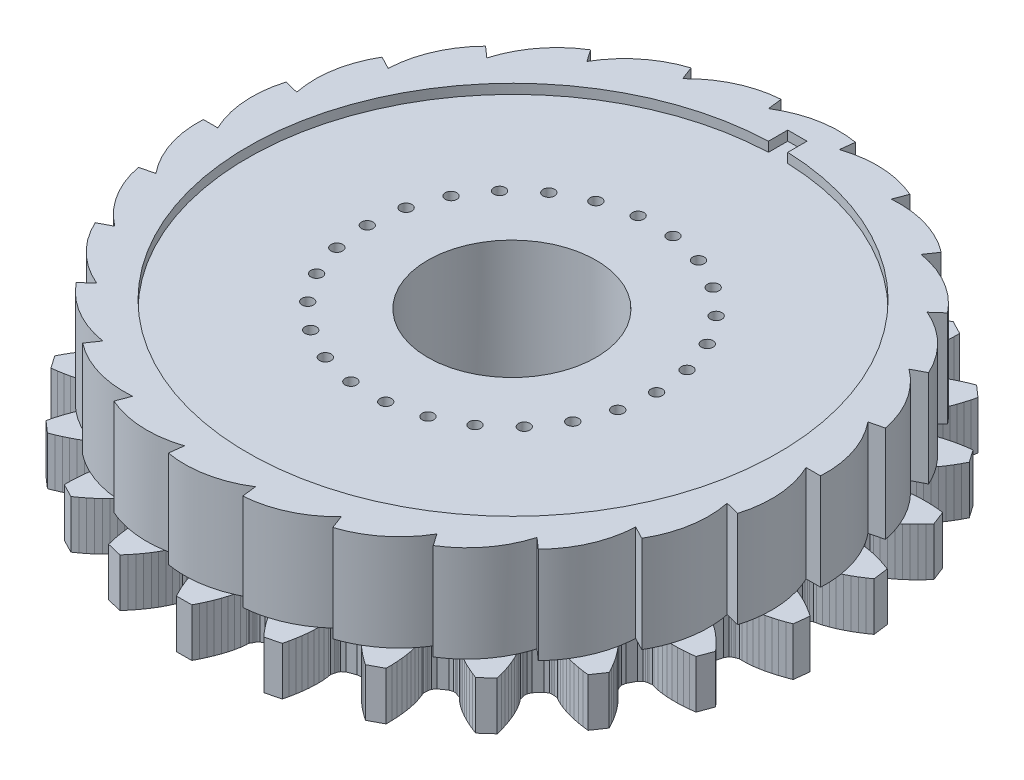
from build123d import *

# Parameters (mm, degrees)
EXTRUDE_RATCHET_EDGE_DEPTH      = 10
PATTERN_EDGE_TO_FORM_GEAR_COUNT = 26
BOSS_EXTRUDE1_DEPTH             = 5
CUT_EXTRUDE1_DEPTH              = 1
SKETCH7_R                       = 8.73125
CUT_BEARING_HOLE_DEPTH          = 51.540175005
CUT_EXTRUDE2_DEPTH              = 1
PIN_HOLES_R                     = 0.6
PIN_HOLES_CUT_DEPTH             = 51.252455557


with BuildPart() as part:
    # Sketch1 → Extrude ratchet edge (new body)
    with BuildSketch(Plane(origin=(0, 0, 0), x_dir=(1, 0, 0), z_dir=(0, 1, 0))):
        with BuildLine():
            Line((0, 0), (29.613725431, 7.299127761))
            ThreePointArc((29.613725431, 7.299127761), (31.486736206, 3.871832194), (32, 0))
            Line((32, 0), (0, 0))
        make_face()
    extrude_ratchet_edge = extrude(amount=EXTRUDE_RATCHET_EDGE_DEPTH)

    # Pattern edge to form gear: Extrude ratchet edge ×26 about axis
    pattern_edge_to_form_gear_axis = Axis((0, 10, 0), (0, -1, 0))
    for i in range(1, PATTERN_EDGE_TO_FORM_GEAR_COUNT):
        add(extrude_ratchet_edge.rotate(pattern_edge_to_form_gear_axis, i * 360 / PATTERN_EDGE_TO_FORM_GEAR_COUNT))

    # Sketch12 → Boss-Extrude1 (add)
    with BuildSketch(Plane.XZ):
        Polygon((29.000322753, -0.616570725), (29.119587194, -1.000264746), (29.243967752, -1.150641256), (29.369415025, -1.259655253), (29.495529063, -1.346043346), (29.746268189, -1.535119797), (30.003897471, -1.579567436), (30.516640797, -1.712184271), (31.026553539, -1.886135894), (31.533608527, -2.093643068), (32.037579583, -2.330772238), (32.538146653, -2.595046761), (33.034971107, -2.88478205), (33.527666394, -3.198716608), (34.015860093, -3.535858565), (33.816447683, -5.104204368), (33.259423516, -5.308446667), (32.70383632, -5.489091421), (32.150321721, -5.64527418), (31.599542211, -5.775878742), (31.052267075, -5.879342703), (30.509417131, -5.953364719), (29.972196294, -5.994166602), (29.442574568, -5.994244969), (29.182025762, -5.972811667), (28.891944574, -6.093118219), (28.748223432, -6.14520138), (28.599490608, -6.219357083), (28.441444822, -6.333825435), (28.229944358, -6.675452702), (28.011930996, -7.539016124), (28.035905017, -7.940101093), (28.120680504, -8.11587518), (28.216392404, -8.251742207), (28.318171308, -8.365801825), (28.516371494, -8.609392662), (28.755875004, -8.714201654), (29.221984208, -8.965662), (29.675451563, -9.256588057), (30.118114109, -9.579423324), (30.550688568, -9.930264942), (30.973466667, -10.306654274), (31.38651869, -10.706875291), (31.789774507, -11.129589828), (32.183089813, -11.57376402), (31.614148649, -13.048821615), (31.024422442, -13.113824584), (30.441754669, -13.156257212), (29.866940695, -13.175436936), (29.300913124, -13.170433674), (28.74478387, -13.139917408), (28.199989292, -13.081870202), (27.668616724, -12.992938215), (27.154372567, -12.866268078), (26.906519987, -12.783095695), (26.596074859, -12.830488087), (26.444073202, -12.84666541), (26.281906356, -12.883072461), (26.101055542, -12.956387938), (25.813953244, -13.237478936), (25.395601274, -14.023771373), (25.322903049, -14.418937666), (25.36315151, -14.609882908), (25.423567498, -14.764713169), (25.495086212, -14.899815322), (25.629240235, -15.18375337), (25.836700176, -15.34283377), (26.229084437, -15.698545455), (26.5997556, -16.089541872), (26.952297616, -16.508926), (27.288334305, -16.95309792), (27.60874497, -17.419728423), (27.914013523, -17.907159909), (28.204392535, -18.414097386), (28.479987881, -18.939503891), (27.57456612, -20.235536172), (26.986427049, -20.157520075), (26.410536073, -20.059275238), (25.847829895, -19.940331997), (25.299444988, -19.800019952), (24.766779121, -19.637304534), (24.251710057, -19.450565246), (23.757057144, -19.237040752), (23.288067034, -18.990988592), (23.06732386, -18.850919437), (22.754565163, -18.822639205), (22.603105727, -18.80196765), (22.436947, -18.798508986), (22.243802823, -18.826415616), (21.897766118, -19.030625641), (21.303407339, -19.69395104), (21.138250905, -20.060236642), (21.131629113, -20.255270487), (21.15323291, -20.420055664), (21.190345242, -20.568356596), (21.252649168, -20.876147677), (21.416005351, -21.080258001), (21.711860329, -21.51952615), (21.97818652, -21.987869562), (22.220124958, -22.479441164), (22.440105609, -22.991119504), (22.639534349, -23.520878226), (22.819282941, -24.067199626), (22.979900363, -24.628903355), (23.121744765, -25.204989299), (21.9324827, -26.246678064), (21.380095096, -26.030181096), (20.844455941, -25.796974682), (20.326564429, -25.54682621), (19.827692045, -25.279348604), (19.349446711, -24.993886816), (18.894032469, -24.689313949), (18.464858212, -24.363608827), (18.068377547, -24.012467795), (17.887567892, -23.823651875), (17.590666424, -23.721340283), (17.448544138, -23.665021206), (17.28804749, -23.621901858), (17.093840034, -23.602769671), (16.708985836, -23.718239631), (15.97315002, -24.220048013), (15.725134742, -24.536171365), (15.672029434, -24.723948024), (15.653578582, -24.889120029), (15.65411946, -25.041981213), (15.640952821, -25.355750311), (15.750721025, -25.593020658), (15.932857792, -26.090329901), (16.079363355, -26.608802942), (16.196623032, -27.143979485), (16.287754102, -27.693433061), (16.35461331, -28.255524246), (16.398396125, -28.828988744), (16.419920067, -29.412802364), (16.419780819, -30.00610275), (15.015774768, -30.732908811), (14.531260836, -30.390507062), (14.066985306, -30.035889374), (13.624010391, -29.669070177), (13.203654281, -29.289980387), (12.807615735, -28.898360741), (12.438328878, -28.493653084), (12.099558756, -28.074708794), (11.798647374, -27.638890005), (11.668278983, -27.412282401), (11.404480071, -27.241895059), (11.279977476, -27.153199468), (11.134456303, -27.072915431), (10.9504697, -27.007865397), (10.549167493, -27.027885368), (9.714626697, -27.339008242), (9.398160425, -27.586590109), (9.301665544, -27.756212723), (9.244218621, -27.912162987), (9.208153758, -28.06071406), (9.120282206, -28.362206086), (9.170082238, -28.618851478), (9.2279035, -29.145296822), (9.246079579, -29.683763509), (9.23185423, -30.231458603), (9.188847542, -30.786760421), (9.119242017, -31.348513156), (9.024511085, -31.915788421), (8.905705047, -32.48780017), (8.763586696, -33.063817482), (7.226437894, -33.433502275), (6.837937921, -32.985100273), (6.472031404, -32.529676197), (6.129704286, -32.06750883), (5.812280994, -31.598839186), (5.521481747, -31.123817442), (5.259772592, -30.642494605), (5.031107581, -30.154653437), (4.843234592, -29.659477328), (4.770887712, -29.408259386), (4.555530022, -29.179687086), (4.455867025, -29.06377419), (4.333788034, -28.951008769), (4.170714536, -28.843816474), (3.776294925, -28.76721382), (2.891539758, -28.869578615), (2.52502445, -29.034226188), (2.390731304, -29.175828609), (2.297638331, -29.313489378), (2.227069377, -29.449108533), (2.069602914, -29.720802038), (2.056530545, -29.981914038), (1.986690404, -30.506898661), (1.875468101, -31.03407206), (1.730592111, -31.562438391), (1.555941953, -32.091313679), (1.353929162, -32.620090883), (1.126186865, -33.148213767), (0.873939275, -33.675157544), (0.598102076, -34.200433621), (-0.982851482, -34.19151211), (-1.252752475, -33.663173567), (-1.499045823, -33.133407539), (-1.720812391, -32.602746652), (-1.916852382, -32.071728851), (-2.085523982, -31.540918984), (-2.224440638, -31.01095302), (-2.329708953, -30.482558192), (-2.393621941, -29.956812623), (-2.403747439, -29.695584546), (-2.558141053, -29.42212011), (-2.627173971, -29.285726091), (-2.718708913, -29.147016563), (-2.851390134, -29.003914445), (-3.216023003, -28.835136551), (-4.099572907, -28.722804032), (-4.494838802, -28.794949523), (-4.659110773, -28.900291221), (-4.782449698, -29.011688949), (-4.883410877, -29.126470152), (-5.101335582, -29.352585333), (-5.176514332, -29.602973032), (-5.369956259, -30.096002681), (-5.604102212, -30.581231923), (-5.871223617, -31.059577533), (-6.167361801, -31.531292677), (-6.490054901, -31.996348472), (-6.837566872, -32.454623894), (-7.208597359, -32.905900588), (-7.602119825, -33.349894441), (-9.1349949, -32.962888546), (-9.270609169, -32.385304489), (-9.382967634, -31.811999182), (-9.471292057, -31.243682867), (-9.534557726, -30.68118305), (-9.571304238, -30.125424566), (-9.579345414, -29.577614654), (-9.555100785, -29.039388168), (-9.49133995, -28.513620637), (-9.438659317, -28.257552614), (-9.523124814, -27.95508868), (-9.557507096, -27.806143986), (-9.613188717, -27.649553535), (-9.707771765, -27.4788597), (-10.02141522, -27.227720352), (-10.85239872, -26.907201408), (-11.253452365, -26.882667311), (-11.438160264, -26.945630464), (-11.584575193, -27.024271004), (-11.710068905, -27.111558462), (-11.975772252, -27.27895371), (-12.108692281, -27.504078732), (-12.41450145, -27.936476133), (-12.757967791, -28.351570645), (-13.131798323, -28.752094327), (-13.532226416, -29.139221659), (-13.956837652, -29.513547094), (-14.403925504, -29.875341691), (-14.872162885, -30.224706134), (-15.360509126, -30.561625939), (-16.756226668, -29.819024441), (-16.749676303, -29.225768585), (-16.721567424, -28.642237772), (-16.671323655, -28.069303029), (-16.598129513, -27.508003101), (-16.500806914, -26.959608074), (-16.377516144, -26.425783946), (-16.225174127, -25.908992736), (-16.037444855, -25.413769059), (-15.925002996, -25.177750852), (-15.934633726, -24.863864715), (-15.93237059, -24.711006785), (-15.948957519, -24.54564826), (-15.999945901, -24.357278631), (-16.244380529, -24.038384318), (-16.97450652, -23.528307117), (-17.358032081, -23.408505109), (-17.552442054, -23.425442954), (-17.713420589, -23.466754535), (-17.856162622, -23.521470062), (-18.154202757, -23.620413876), (-18.337128687, -23.807183441), (-18.737535133, -24.153834168), (-19.170366722, -24.474676527), (-19.629185448, -24.774089579), (-20.110618025, -25.054149625), (-20.612472996, -25.315973506), (-21.133151156, -25.560268493), (-21.671390651, -25.787419074), (-22.226177153, -25.997672501), (-23.403626964, -24.942639576), (-23.255288098, -24.368188855), (-23.088349817, -23.80833472), (-22.902449685, -23.264069562), (-22.697053973, -22.736597099), (-22.471322079, -22.227435416), (-22.223855341, -21.738624109), (-21.952265664, -21.27331251), (-21.651477182, -20.837403058), (-21.485824938, -20.635156317), (-21.420055759, -20.328083392), (-21.381271653, -20.180210934), (-21.357809987, -20.015687572), (-21.362236574, -19.82059187), (-21.523243562, -19.452463818), (-22.110092119, -18.782478907), (-22.453804627, -18.574372227), (-22.646613151, -18.544291821), (-22.812807694, -18.545881951), (-22.964493043, -18.564846539), (-23.277546869, -18.589594427), (-23.499862021, -18.727158029), (-23.971598705, -18.967906757), (-24.468627261, -19.175844193), (-24.98576773, -19.356757169), (-25.520238803, -19.513463985), (-26.070163438, -19.647578616), (-26.634174291, -19.760160953), (-27.211133094, -19.851912386), (-27.800124899, -19.92328565), (-28.690864881, -18.617123329), (-28.409361987, -18.094864868), (-28.113294466, -17.591229677), (-27.802546925, -17.107273162), (-27.476891545, -16.644285167), (-27.1358604, -16.203933489), (-26.77861044, -15.788547198), (-26.403559404, -15.401758463), (-26.007179513, -15.050502158), (-25.797945655, -14.893766904), (-25.660597374, -14.611361624), (-25.587555822, -14.477064875), (-25.525397405, -14.322930519), (-25.48300824, -14.132450996), (-25.551244776, -13.736489569), (-25.960701815, -12.945524905), (-26.244620576, -12.661214427), (-26.424630906, -12.585862173), (-26.586363252, -12.547634199), (-26.738187542, -12.529745553), (-27.048075686, -12.4788541), (-27.296840395, -12.559223583), (-27.812481624, -12.680085797), (-28.344830202, -12.763030442), (-28.890241656, -12.814926193), (-29.446685345, -12.839171433), (-30.012733696, -12.837784214), (-30.587294313, -12.81211922), (-31.169446576, -12.763119563), (-31.758393322, -12.691474467), (-32.310669441, -11.210098191), (-31.912366652, -10.770380015), (-31.50437105, -10.352244135), (-31.086839486, -9.956710155), (-30.659842686, -9.585103596), (-30.223339518, -9.239164688), (-29.777060902, -8.921352719), (-29.320342312, -8.635558244), (-28.851424719, -8.389359586), (-28.610758156, -8.287264153), (-28.40981339, -8.045926773), (-28.306761313, -7.933018707), (-28.20952209, -7.798234883), (-28.122771512, -7.623435151), (-28.094268231, -7.222644135), (-28.302534861, -6.35667719), (-28.510162717, -6.012682159), (-28.666910843, -5.896446425), (-28.814801839, -5.820622528), (-28.957928583, -5.766919605), (-29.246631907, -5.643339808), (-29.507410899, -5.661843284), (-30.036983429, -5.655790674), (-30.573721657, -5.608927158), (-31.115698356, -5.528792204), (-31.661774369, -5.419161369), (-32.211037265, -5.282350073), (-32.76276366, -5.119932614), (-33.31627317, -4.933044941), (-33.870961032, -4.722526552), (-34.052673274, -3.152034331), (-33.560714796, -2.820412738), (-33.064502668, -2.512060415), (-32.564446541, -2.227950137), (-32.060931426, -1.969333767), (-31.554319305, -1.737902569), (-31.044951834, -1.536117796), (-30.53311266, -1.367929707), (-30.018904959, -1.24111436), (-29.760795544, -1.19956902), (-29.507935476, -1.013340126), (-29.380858158, -0.928372969), (-29.254185749, -0.820775989), (-29.128129032, -0.671814544), (-29.004538852, -0.289492375), (-28.999514125, 0.601141182), (-29.118778566, 0.984835202), (-29.243159124, 1.135211713), (-29.368606397, 1.24422571), (-29.494720435, 1.330613803), (-29.745459561, 1.519690254), (-30.003078857, 1.564138416), (-30.515832169, 1.696754727), (-31.025744911, 1.870706351), (-31.532799898, 2.078213525), (-32.036770955, 2.315342695), (-32.537338025, 2.579617218), (-33.034162479, 2.869352507), (-33.526857766, 3.183287064), (-34.015051465, 3.520429021), (-33.815639055, 5.088774824), (-33.258614888, 5.293017123), (-32.703027691, 5.473661878), (-32.149513093, 5.629844637), (-31.598733583, 5.760449198), (-31.051458447, 5.86391316), (-30.508608503, 5.937935175), (-29.971378203, 5.978747568), (-29.441765939, 5.978815426), (-29.181217134, 5.957382123), (-28.891135946, 6.077688675), (-28.747414804, 6.129771837), (-28.59868198, 6.203927539), (-28.440636194, 6.318395892), (-28.229136253, 6.660033145), (-28.011122368, 7.52358658), (-28.035096389, 7.92467155), (-28.119871875, 8.100445636), (-28.215583776, 8.236312663), (-28.31736268, 8.350372282), (-28.515562866, 8.593963118), (-28.755066376, 8.69877211), (-29.22117558, 8.950232457), (-29.674643458, 9.2411685), (-30.11730548, 9.56399378), (-30.54987994, 9.914835398), (-30.972658039, 10.291224731), (-31.385710062, 10.691445747), (-31.788965879, 11.114160284), (-32.182281185, 11.558334477), (-31.613340021, 13.033392072), (-31.023613814, 13.098395041), (-30.44094604, 13.140827669), (-29.866132067, 13.160007393), (-29.300104495, 13.15500413), (-28.743975242, 13.124487865), (-28.199181187, 13.066450645), (-27.667808095, 12.977508672), (-27.153563939, 12.850838534), (-26.905711359, 12.767666151), (-26.595266231, 12.815058544), (-26.443264574, 12.831235866), (-26.281097728, 12.867642918), (-26.100246914, 12.940958394), (-25.813144616, 13.222049393), (-25.394792646, 14.00834183), (-25.322094421, 14.403508123), (-25.362342882, 14.594453365), (-25.42275887, 14.749283626), (-25.494277584, 14.884385778), (-25.62843213, 15.168333813), (-25.835891548, 15.327404226), (-26.228275809, 15.683115911), (-26.598946972, 16.074112328), (-26.951488988, 16.493496456), (-27.287525677, 16.937668377), (-27.607936342, 17.404298879), (-27.913204895, 17.891730366), (-28.203583907, 18.398667843), (-28.479179252, 18.924074348), (-27.573757492, 20.220106629), (-26.985618421, 20.142090531), (-26.409727445, 20.043845695), (-25.847021791, 19.92491244), (-25.29863636, 19.784590409), (-24.765970493, 19.621874991), (-24.250901429, 19.435135703), (-23.756248516, 19.221611208), (-23.287258406, 18.975559048), (-23.066515232, 18.835489893), (-22.753757058, 18.807219648), (-22.602297099, 18.786538107), (-22.436138372, 18.783079442), (-22.242994194, 18.810986073), (-21.896958013, 19.015206084), (-21.302598711, 19.678521497), (-21.137442277, 20.044807098), (-21.130821008, 20.23985093), (-21.152424282, 20.40462612), (-21.189536614, 20.552927052), (-21.251830554, 20.860718657), (-21.415196723, 21.064828458), (-21.711052224, 21.504106592), (-21.977377892, 21.972440019), (-22.21931633, 22.464011621), (-22.439296981, 22.975689961), (-22.638725721, 23.505448683), (-22.818474313, 24.051770083), (-22.979091735, 24.613473812), (-23.120936137, 25.189559755), (-21.931674072, 26.231248521), (-21.379286468, 26.014751553), (-20.843647312, 25.781545139), (-20.325755801, 25.531396667), (-19.826883417, 25.263919061), (-19.348638083, 24.978457272), (-18.893223841, 24.673884406), (-18.464049584, 24.348179283), (-18.067568919, 23.997038251), (-17.886759264, 23.808222332), (-17.589857796, 23.70591074), (-17.44773551, 23.649591662), (-17.287238862, 23.606472314), (-17.093031406, 23.587340127), (-16.708177208, 23.702810087), (-15.972341392, 24.204618469), (-15.724326113, 24.520741822), (-15.671220805, 24.70851848), (-15.652769954, 24.873690486), (-15.653310832, 25.026551669), (-15.640144193, 25.340320768), (-15.749912397, 25.577591115), (-15.932049164, 26.074900358), (-16.078554727, 26.593373398), (-16.195814403, 27.128549942), (-16.286945474, 27.678003517), (-16.353804682, 28.240094703), (-16.397587497, 28.813559201), (-16.419111439, 29.397372821), (-16.418972191, 29.990673206), (-15.01496614, 30.717479268), (-14.530452208, 30.375077518), (-14.066176678, 30.020459831), (-13.623201763, 29.653640633), (-13.202845653, 29.274550843), (-12.806807107, 28.882931198), (-12.43752025, 28.478223541), (-12.098750128, 28.059279251), (-11.797838746, 27.623460461), (-11.667470355, 27.396852858), (-11.403671443, 27.226465516), (-11.279158862, 27.137770448), (-11.133647675, 27.057485887), (-10.949661072, 26.992435853), (-10.548358865, 27.012455825), (-9.713818069, 27.323578698), (-9.397351797, 27.571160566), (-9.300856916, 27.74078318), (-9.243409993, 27.896733444), (-9.20734513, 28.045284517), (-9.119473578, 28.346776543), (-9.16927361, 28.603421934), (-9.227094872, 29.129867278), (-9.245270951, 29.668333966), (-9.231045602, 30.21602906), (-9.188038914, 30.771330878), (-9.118433389, 31.333083612), (-9.023702457, 31.900358877), (-8.904896419, 32.472370627), (-8.762778068, 33.048387938), (-7.225629266, 33.418072731), (-6.837129293, 32.969670729), (-6.47121279, 32.514247177), (-6.128895658, 32.052079287), (-5.811472366, 31.583409643), (-5.520673118, 31.108387899), (-5.258963964, 30.627065061), (-5.030298953, 30.139223894), (-4.842425964, 29.644047785), (-4.770079084, 29.392829842), (-4.554721394, 29.164257543), (-4.455058397, 29.048344646), (-4.332979406, 28.935579226), (-4.169905908, 28.82838693), (-3.775486297, 28.751784276), (-2.89073113, 28.854149072), (-2.524215821, 29.018796644), (-2.389922676, 29.160399066), (-2.296830226, 29.298069821), (-2.226260749, 29.43367899), (-2.068794286, 29.705372494), (-2.055721917, 29.966484494), (-1.985881775, 30.491469118), (-1.874659473, 31.018642516), (-1.729783483, 31.547008847), (-1.555133325, 32.075884136), (-1.353120534, 32.604661339), (-1.125378237, 33.132784224), (-0.873130647, 33.659728001), (-0.597293447, 34.185004077), (0.98366011, 34.176082567), (1.253561103, 33.647744024), (1.499854451, 33.117977996), (1.721620496, 32.587327095), (1.91766101, 32.056299308), (2.08633261, 31.525489441), (2.225249266, 30.995523477), (2.330517582, 30.467128648), (2.394430569, 29.941383079), (2.404556067, 29.680155003), (2.558949681, 29.406690567), (2.627982599, 29.270296547), (2.719517541, 29.131587019), (2.852198762, 28.988484902), (3.216841617, 28.819707531), (4.100381535, 28.707374489), (4.49564743, 28.77951998), (4.659919401, 28.884861678), (4.783258326, 28.996259405), (4.884219506, 29.111040609), (5.10214421, 29.337155789), (5.177322436, 29.587553475), (5.370764887, 30.080573137), (5.60491084, 30.565802379), (5.872032245, 31.044147989), (6.168170429, 31.515863134), (6.490863529, 31.980918928), (6.8383755, 32.43919435), (7.209405987, 32.890471045), (7.602928453, 33.334464897), (9.135803529, 32.947459002), (9.271417797, 32.369874946), (9.383776262, 31.796569638), (9.472100685, 31.228253324), (9.535366355, 30.665753507), (9.572112866, 30.109995023), (9.580154042, 29.562185111), (9.555909413, 29.023958624), (9.492148578, 28.498191094), (9.439467946, 28.24212307), (9.523933442, 27.939659137), (9.558315724, 27.790714443), (9.613997345, 27.634123992), (9.708580393, 27.463430156), (10.022223848, 27.212290809), (10.853207348, 26.891771865), (11.254260993, 26.867237767), (11.438968892, 26.930200921), (11.585383821, 27.00884146), (11.710877533, 27.096128918), (11.97658088, 27.263524166), (12.109500909, 27.488649189), (12.415310078, 27.92104659), (12.758776419, 28.336141102), (13.132606951, 28.736664784), (13.533035044, 29.123792116), (13.95764628, 29.498117551), (14.404734132, 29.859912148), (14.872971513, 30.209276591), (15.361317754, 30.546196395), (16.757035296, 29.803594898), (16.750484932, 29.210339042), (16.722376052, 28.626808228), (16.672132283, 28.053873485), (16.598938141, 27.492573558), (16.501615542, 26.94417853), (16.378324773, 26.410354402), (16.225982755, 25.893563193), (16.038253483, 25.398339515), (15.925811624, 25.162321308), (15.935442354, 24.848435171), (15.933179218, 24.695577242), (15.949766147, 24.530218716), (16.000754529, 24.341849088), (16.245189157, 24.022954774), (16.975315148, 23.512877573), (17.358840709, 23.393075566), (17.553250683, 23.41001341), (17.714229217, 23.451324992), (17.85697125, 23.506040519), (18.155011385, 23.604984333), (18.337937315, 23.791753898), (18.738343761, 24.138404625), (19.17117535, 24.459246983), (19.629994076, 24.758660035), (20.111426653, 25.038720082), (20.613281624, 25.300543962), (21.133959784, 25.544838949), (21.67219928, 25.77198953), (22.226985781, 25.982242957), (23.404435592, 24.927210033), (23.256096727, 24.352759312), (23.089158445, 23.792905177), (22.903257789, 23.248650005), (22.697862601, 22.721167555), (22.472130707, 22.212005872), (22.224663969, 21.723194565), (21.953074293, 21.257882966), (21.65228581, 20.821973515), (21.486633566, 20.619726774), (21.420864387, 20.312653848), (21.382080281, 20.164781391), (21.358618615, 20.000258029), (21.363045202, 19.805162326), (21.52405219, 19.437034274), (22.110900747, 18.767049364), (22.454613255, 18.558942684), (22.647421779, 18.528862278), (22.813616322, 18.530452408), (22.965301672, 18.549416996), (23.278365483, 18.574165406), (23.500670649, 18.711728485), (23.972407333, 18.952477213), (24.469435889, 19.160414649), (24.986576358, 19.341327625), (25.521047431, 19.498034441), (26.070972066, 19.632149072), (26.634982919, 19.74473141), (27.211941722, 19.836482843), (27.800933527, 19.907856106), (28.691673509, 18.601693785), (28.410170615, 18.079435325), (28.114103094, 17.575800134), (27.803355553, 17.091843618), (27.477700173, 16.628855624), (27.136669028, 16.188503946), (26.779419068, 15.773117655), (26.404368032, 15.38632892), (26.007988141, 15.035072615), (25.798754283, 14.87833736), (25.661406002, 14.59593208), (25.58836445, 14.461635332), (25.526206033, 14.307500976), (25.483816868, 14.117021453), (25.552053404, 13.721060026), (25.961510443, 12.930095362), (26.245429204, 12.645784884), (26.425439534, 12.570432629), (26.587171881, 12.532204656), (26.73899617, 12.51431601), (27.048884314, 12.463424557), (27.297649023, 12.54379404), (27.813290252, 12.664656254), (28.34563883, 12.747600898), (28.891050284, 12.79949665), (29.447493973, 12.82374189), (30.013542324, 12.82235467), (30.588102941, 12.796689676), (31.170255204, 12.74769002), (31.75920195, 12.676044924), (32.311478069, 11.194668648), (31.91317528, 10.754950472), (31.505179678, 10.336814591), (31.087648114, 9.941280612), (30.660651315, 9.569674052), (30.224148146, 9.223735144), (29.77786953, 8.905923176), (29.32115094, 8.6201287), (28.852233347, 8.373930043), (28.611566784, 8.27183461), (28.410622018, 8.030497229), (28.307569941, 7.917589163), (28.210330718, 7.782805339), (28.123580141, 7.608005608), (28.095076859, 7.207214591), (28.303343489, 6.341247647), (28.510971345, 5.997252616), (28.667719471, 5.881016882), (28.815610467, 5.805192985), (28.958737211, 5.751490062), (29.247440535, 5.627910264), (29.508219527, 5.646413741), (30.037792057, 5.640361131), (30.574530285, 5.593497614), (31.116506984, 5.513362661), (31.662582997, 5.403731826), (32.211845893, 5.26692053), (32.763572288, 5.104503071), (33.317081798, 4.917615397), (33.87176966, 4.707097009), (34.053481903, 3.136604788), (33.561523424, 2.804983194), (33.065311296, 2.496630872), (32.565255169, 2.212520593), (32.061740055, 1.953904223), (31.555127933, 1.722473025), (31.045760462, 1.520688252), (30.533921289, 1.352500164), (30.019713587, 1.225684816), (29.761604172, 1.184139477), (29.508744104, 0.997910583), (29.381666786, 0.912943425), (29.254994377, 0.805346446), (29.12893766, 0.656385001), (29.00534748, 0.274062831), align=None)
    extrude(amount=BOSS_EXTRUDE1_DEPTH)

    # Sketch10 → Cut-Extrude1 (cut)
    with BuildSketch(Plane(origin=(0, 10, 0), x_dir=(1, 0, 0), z_dir=(0, 1, 0))):
        with BuildLine():
            Line((-0.753755436, 29.351723584), (-0.753755436, 27.351723584))
            ThreePointArc((-0.753755436, 27.351723584), (0.246244564, -27.630088583), (1.246244564, 27.351723584))
            Line((1.246244564, 27.351723584), (1.246244564, 29.351723584))
            Line((1.246244564, 29.351723584), (-0.753755436, 29.351723584))
        make_face()
    extrude(amount=-CUT_EXTRUDE1_DEPTH, mode=Mode.SUBTRACT)

    # Sketch7 → Cut bearing hole (cut, through all)
    with BuildSketch(Plane(origin=(0, 10, 0), x_dir=(1, 0, 0), z_dir=(0, 1, 0))):
        Circle(SKETCH7_R)
    extrude(amount=-CUT_BEARING_HOLE_DEPTH, mode=Mode.SUBTRACT)

    # Sketch11 → Cut-Extrude2 (cut)
    with BuildSketch(Plane.XZ.offset(5)):
        with BuildLine():
            Line((1, -29.481812167), (1, -27.481812167))
            ThreePointArc((1, -27.481812167), (0, 27.5), (-1, -27.481812167))
            Line((-1, -27.481812167), (-1, -29.481812167))
            Line((-1, -29.481812167), (1, -29.481812167))
        make_face()
    extrude(amount=-CUT_EXTRUDE2_DEPTH, mode=Mode.SUBTRACT)

    # pin holes → Pin holes cut (cut, through all)
    with BuildSketch(Plane(origin=(0, 9, 0), x_dir=(1, 0, 0), z_dir=(0, 1, 0))):
        with Locations((15, 0)):
            Circle(PIN_HOLES_R)
        with Locations((14.564127261, -3.589734964)):
            Circle(PIN_HOLES_R)
        with Locations((13.281840385, -6.970847581)):
            Circle(PIN_HOLES_R)
        with Locations((11.227661223, -9.946839874)):
            Circle(PIN_HOLES_R)
        with Locations((8.520971201, -12.344757988)):
            Circle(PIN_HOLES_R)
        with Locations((5.319073306, -14.02524364)):
            Circle(PIN_HOLES_R)
        with Locations((1.808050204, -14.890633111)):
            Circle(PIN_HOLES_R)
        with Locations((-1.808050204, -14.890633111)):
            Circle(PIN_HOLES_R)
        with Locations((-5.319073306, -14.02524364)):
            Circle(PIN_HOLES_R)
        with Locations((-8.520971201, -12.344757988)):
            Circle(PIN_HOLES_R)
        with Locations((-11.227661223, -9.946839874)):
            Circle(PIN_HOLES_R)
        with Locations((-13.281840385, -6.970847581)):
            Circle(PIN_HOLES_R)
        with Locations((-14.564127261, -3.589734964)):
            Circle(PIN_HOLES_R)
        with Locations((-15, 0)):
            Circle(PIN_HOLES_R)
        with Locations((-14.564127261, 3.589734964)):
            Circle(PIN_HOLES_R)
        with Locations((-13.281840385, 6.970847581)):
            Circle(PIN_HOLES_R)
        with Locations((-11.227661223, 9.946839874)):
            Circle(PIN_HOLES_R)
        with Locations((-8.520971201, 12.344757988)):
            Circle(PIN_HOLES_R)
        with Locations((-5.319073306, 14.02524364)):
            Circle(PIN_HOLES_R)
        with Locations((-1.808050204, 14.890633111)):
            Circle(PIN_HOLES_R)
        with Locations((1.808050204, 14.890633111)):
            Circle(PIN_HOLES_R)
        with Locations((5.319073306, 14.02524364)):
            Circle(PIN_HOLES_R)
        with Locations((8.520971201, 12.344757988)):
            Circle(PIN_HOLES_R)
        with Locations((11.227661223, 9.946839874)):
            Circle(PIN_HOLES_R)
        with Locations((13.281840385, 6.970847581)):
            Circle(PIN_HOLES_R)
        with Locations((14.564127261, 3.589734964)):
            Circle(PIN_HOLES_R)
    extrude(amount=-PIN_HOLES_CUT_DEPTH, mode=Mode.SUBTRACT)


solid = part.part
